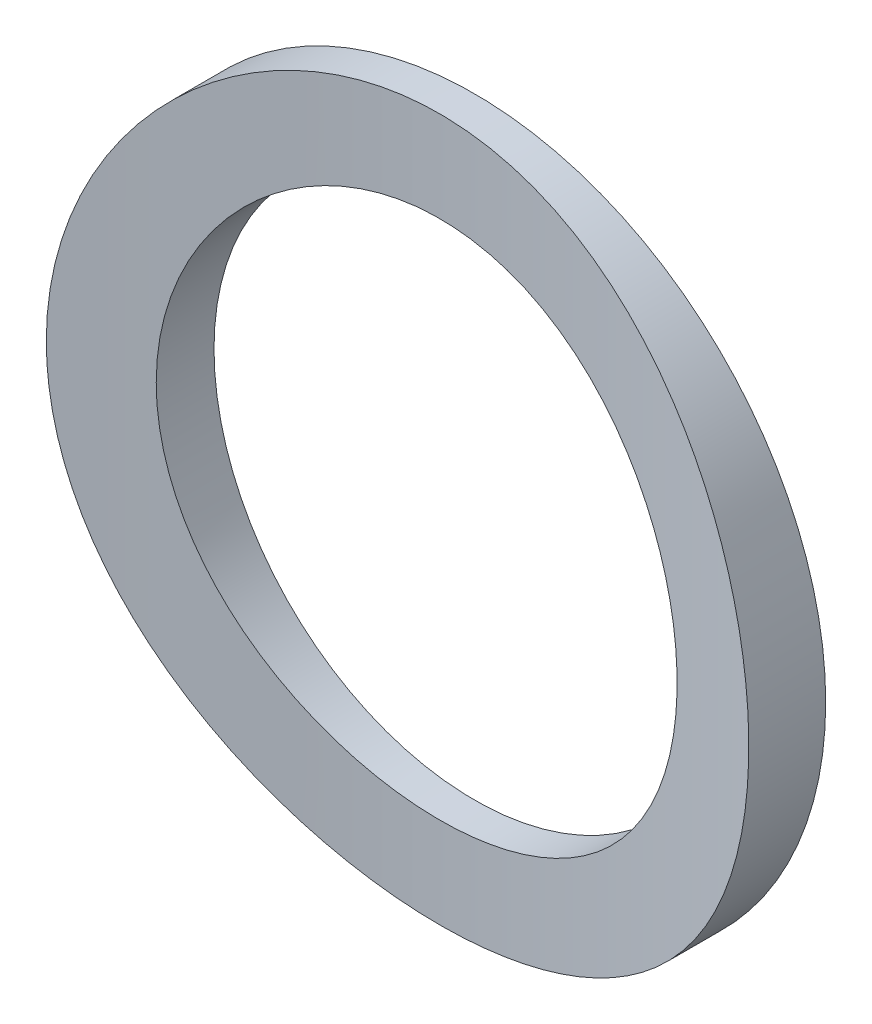
from build123d import *

# Parameters (mm, degrees)
SKETCH1_R               = 10.115
SKETCH1_R_2             = 7.5
BOSS_EXTRUDE1_DEPTH     = 30
CUT_EXTRUDE1_DEPTH      = 34.235921079
CUT_EXTRUDE1_DEPTH_BACK = 34.235921079
SKETCH2_R               = 42.725


with BuildPart() as part:
    # Sketch1 → Boss-Extrude1 (new body)
    with BuildSketch(Plane.XY):
        Circle(SKETCH1_R)
        Circle(SKETCH1_R_2, mode=Mode.SUBTRACT)
    extrude(amount=BOSS_EXTRUDE1_DEPTH)

    # Sketch2 → Cut-Extrude1 (cut, two sides: drawn at the far end of the back side and taken through both)
    with BuildSketch(Plane(origin=(0, 0, 0), x_dir=(1, 0, 0), z_dir=(0, 1, 0)).offset(-CUT_EXTRUDE1_DEPTH_BACK)):
        with Locations((0, -43.725)):
            Circle(SKETCH2_R)
    extrude(amount=CUT_EXTRUDE1_DEPTH + CUT_EXTRUDE1_DEPTH_BACK, mode=Mode.SUBTRACT)


solid = part.part
